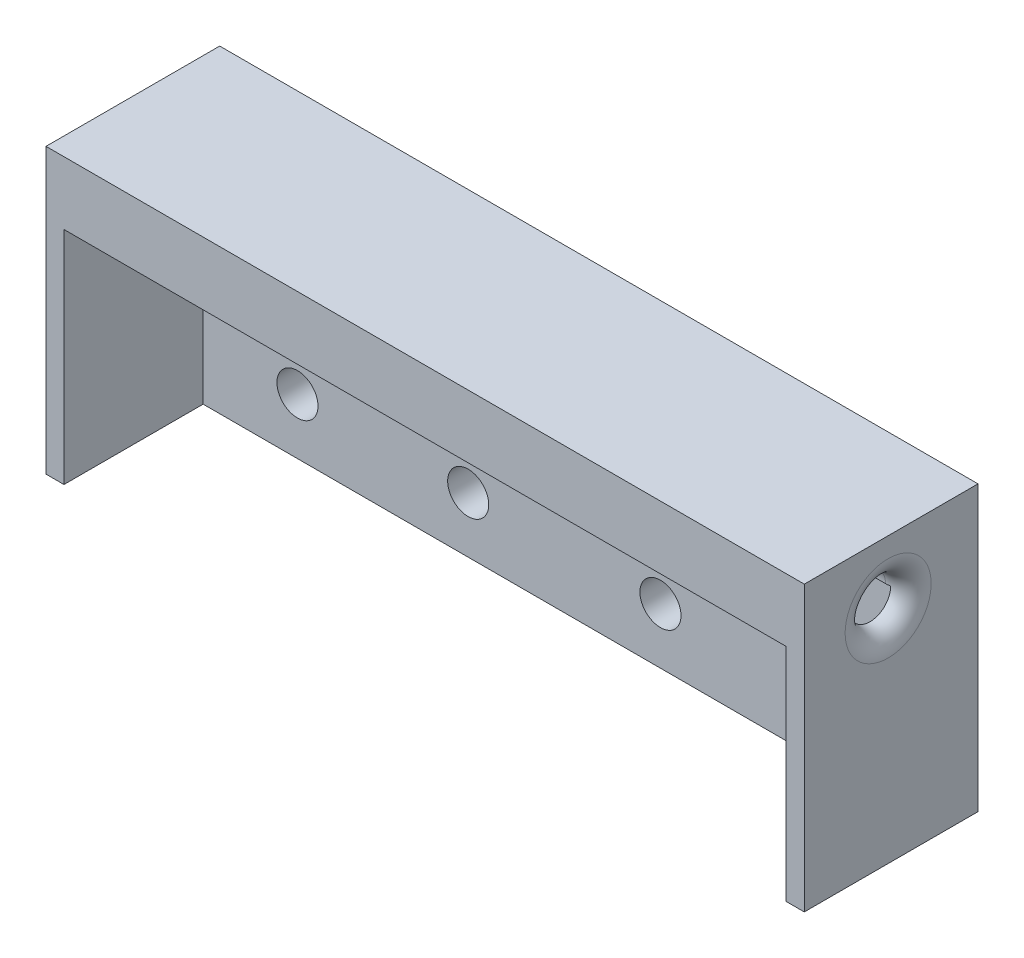
from build123d import *

# Parameters (mm, degrees)
SKETCH1_W               = 42.2
SKETCH1_H               = 15.8
BOSS_EXTRUDE1_DEPTH     = 9.666666667
CUT_EXTRUDE1_DEPTH      = 47.086054772
CUT_EXTRUDE1_DEPTH_BACK = 47.086054772
SKETCH2_R               = 1.125
SKETCH3_W               = 40.1894
SKETCH3_H               = 12.2936
CUT_EXTRUDE3_DEPTH      = 7.745557598
FILLET1_R               = 1.27
CUT_EXTRUDE4_DEPTH      = 46.721698049
CUT_EXTRUDE4_DEPTH_BACK = 46.721698049
SKETCH4_R               = 1.143


with BuildPart() as part:
    # Sketch1 → Boss-Extrude1 (new body)
    with BuildSketch(Plane.XY):
        with Locations((21.1, 7.9)):
            Rectangle(SKETCH1_W, SKETCH1_H)
    extrude(amount=BOSS_EXTRUDE1_DEPTH)

    # Sketch2 → Cut-Extrude1 (cut, two sides: drawn at the far end of the back side and taken through both)
    with BuildSketch(Plane(origin=(42.2, 0, 0), x_dir=(0, 0, -1), z_dir=(1, 0, 0)).offset(-CUT_EXTRUDE1_DEPTH_BACK)):
        with Locations((-5, 12.3)):
            Circle(SKETCH2_R)
    extrude(amount=CUT_EXTRUDE1_DEPTH + CUT_EXTRUDE1_DEPTH_BACK, mode=Mode.SUBTRACT)

    # Sketch3 → Cut-Extrude3 (cut)
    with BuildSketch(Plane.XY.offset(9.666666667)):
        with Locations((21.0947, 6.1468)):
            Rectangle(SKETCH3_W, SKETCH3_H)
    extrude(amount=-CUT_EXTRUDE3_DEPTH, mode=Mode.SUBTRACT)

    # Fillet1
    # the kernel refuses this fillet: 1.27 mm, written as the material it takes off along each edge
    with BuildSketch(Plane(origin=(0, 12.3, 5), x_dir=(0, 0, -1), z_dir=(0, -1, 0))) as fillet1_piece_1:
        with BuildLine():
            CenterArc((1.125 + FILLET1_R, FILLET1_R), FILLET1_R, 180, 90)
            Line((1.125, FILLET1_R), (1.125, 0))
            Line((1.125, 0), (1.125 + FILLET1_R, 0))
        make_face()
    revolve(axis=Axis((0, 12.3, 5), (1, 0, 0)), mode=Mode.SUBTRACT)
    with BuildSketch(Plane(origin=(42.2, 12.3, 5), x_dir=(0, 0, -1), z_dir=(0, -1, 0))) as fillet1_piece_2:
        with BuildLine():
            CenterArc((1.125 + FILLET1_R, -FILLET1_R), FILLET1_R, 90, 90)
            Line((1.125, -FILLET1_R), (1.125, 0))
            Line((1.125, 0), (1.125 + FILLET1_R, 0))
        make_face()
    revolve(axis=Axis((42.2, 12.3, 5), (1, 0, 0)), mode=Mode.SUBTRACT)

    # Sketch4 → Cut-Extrude4 (cut, two sides: drawn at the far end of the back side and taken through both)
    with BuildSketch(Plane.XY.offset(1.921109069).offset(-CUT_EXTRUDE4_DEPTH_BACK)):
        with Locations((6.25, 3.1)):
            Circle(SKETCH4_R)
        with Locations((15.75, 3.1)):
            Circle(SKETCH4_R)
        with Locations((26.45, 3.1)):
            Circle(SKETCH4_R)
        with Locations((35.95, 3.1)):
            Circle(SKETCH4_R)
    extrude(amount=CUT_EXTRUDE4_DEPTH + CUT_EXTRUDE4_DEPTH_BACK, mode=Mode.SUBTRACT)


solid = part.part
